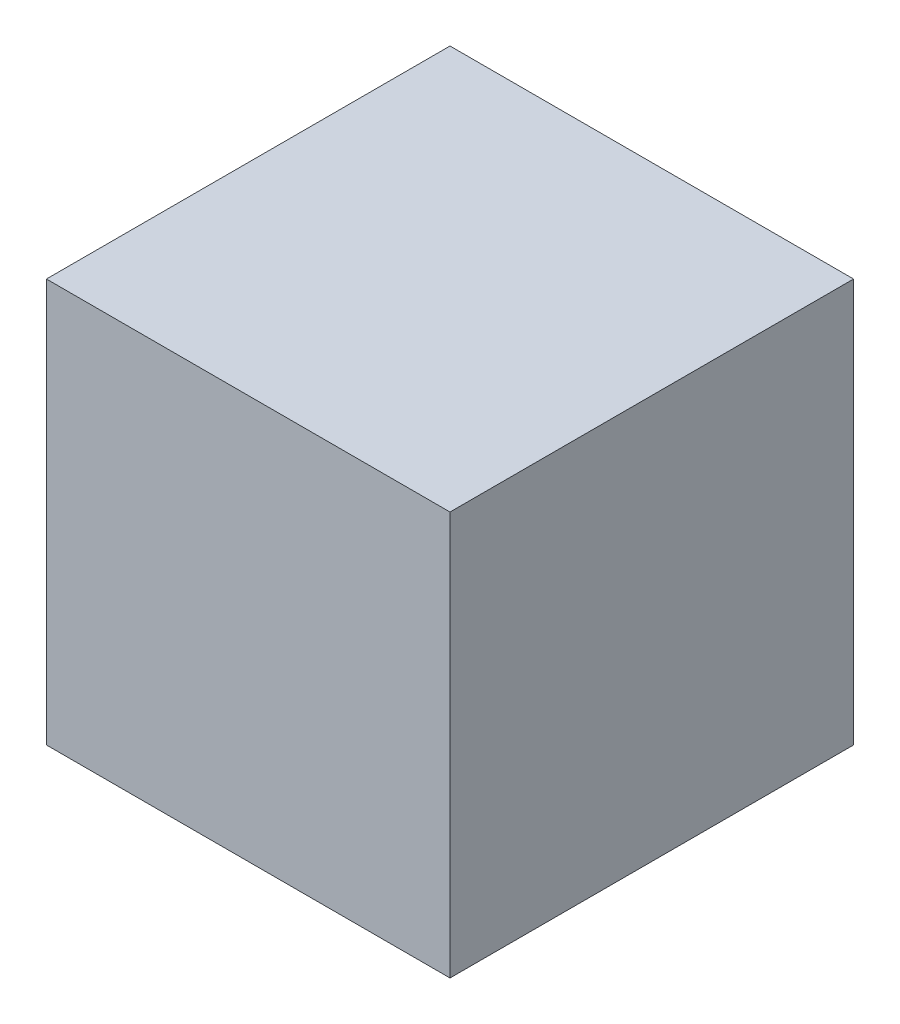
from build123d import *

# Parameters (mm, degrees)
ESQUISSE1_W             = 80
ESQUISSE1_H             = 80
BOSS_EXTRU_1_DEPTH      = 80
ESQUISSE1_4_R           = 20
ESQUISSE1_4_R_2         = 1.5
ENL_V_MAT_EXTRU_1_DEPTH = 3


with BuildPart() as part:
    # Esquisse1 → Boss.-Extru.1 (new body)
    with BuildSketch(Plane.XY):
        Rectangle(ESQUISSE1_W, ESQUISSE1_H)
    extrude(amount=BOSS_EXTRU_1_DEPTH)

    # Esquisse1<4> → Enlèv. mat.-Extru.1 (cut)
    with BuildSketch(Plane.XY):
        Circle(ESQUISSE1_4_R)
        with Locations((15, 0)):
            Circle(ESQUISSE1_4_R_2, mode=Mode.SUBTRACT)
    extrude(amount=ENL_V_MAT_EXTRU_1_DEPTH, mode=Mode.SUBTRACT)


solid = part.part
